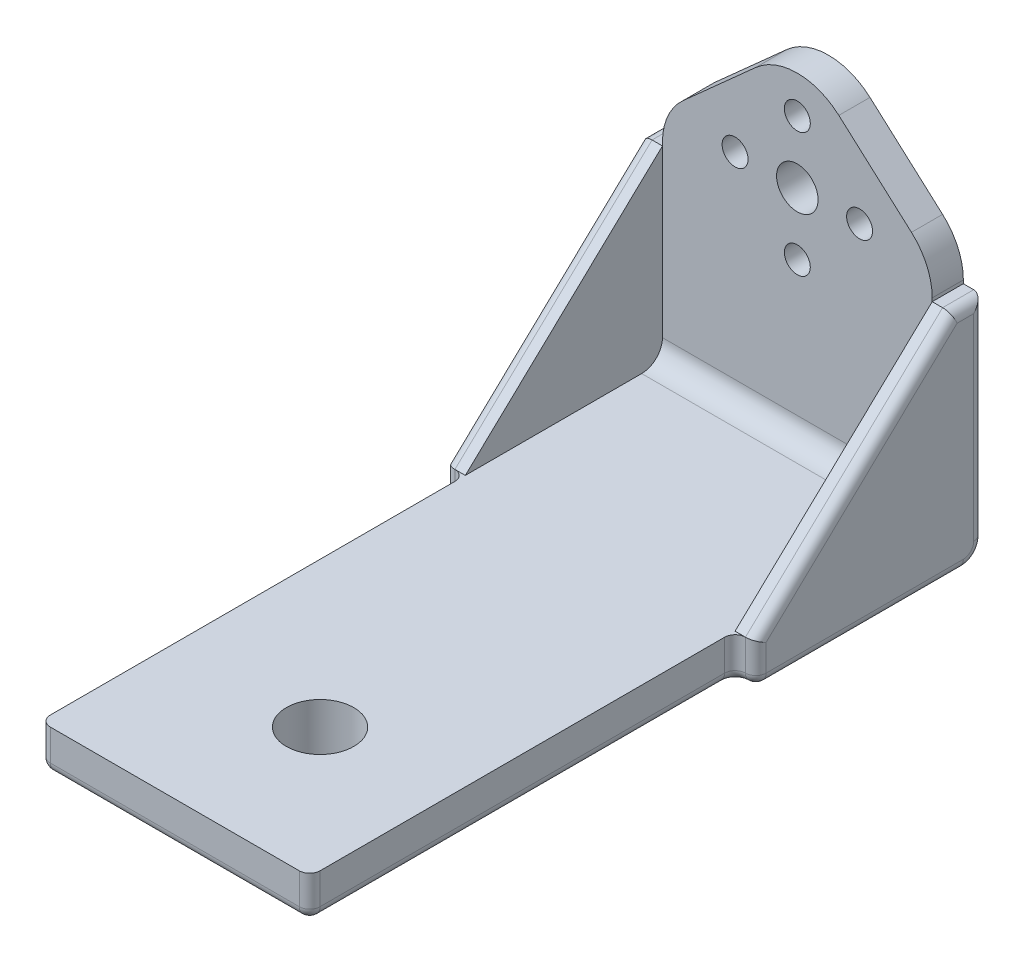
from build123d import *

# Parameters (mm, degrees)
SKETCH1_R           = 2
SKETCH1_R_2         = 1.25
BOSS_EXTRUDE1_DEPTH = 3
SKETCH2_W           = 26
SKETCH2_H           = 4
BOSS_EXTRUDE2_DEPTH = 60
SKETCH3_R           = 3.25
CUT_EXTRUDE1_DEPTH  = 72.226350639
SKETCH4_R           = 8
SKETCH4_R_2         = 3.25
BOSS_EXTRUDE3_DEPTH = 1
SKETCH5_R           = 1.5
BOSS_EXTRUDE4_DEPTH = 3
BOSS_EXTRUDE5_DEPTH = 2
FILLET1_R           = 2
FILLET2_R           = 1
FILLET3_R           = 0.5


# Some blends are built 0.0001 mm under size
with BuildPart() as part:
    # Sketch1 → Boss-Extrude1 (new body)
    with BuildSketch(Plane.XY):
        with BuildLine():
            Line((-13, -2.68256679), (-13, -25))
            Line((-13, -25), (13, -25))
            Line((13, -25), (13, -2.68256679))
            ThreePointArc((13, -2.68256679), (12.477468733, -0.233620837), (11.000887907, 1.788774838))
            Line((11.000887907, 1.788774838), (4.000887907, 8.052267471))
            ThreePointArc((4.000887907, 8.052267471), (0, 9.580925842), (-4.000887907, 8.052267471))
            Line((-4.000887907, 8.052267471), (-11.000887907, 1.788774838))
            ThreePointArc((-11.000887907, 1.788774838), (-12.477468733, -0.233620837), (-13, -2.68256679))
        make_face()
        Circle(SKETCH1_R, mode=Mode.SUBTRACT)
        with Locations((-6, 0)):
            Circle(SKETCH1_R_2, mode=Mode.SUBTRACT)
        with Locations((0, 6)):
            Circle(SKETCH1_R_2, mode=Mode.SUBTRACT)
        with Locations((6, 0)):
            Circle(SKETCH1_R_2, mode=Mode.SUBTRACT)
        with Locations((0, -6)):
            Circle(SKETCH1_R_2, mode=Mode.SUBTRACT)
    extrude(amount=BOSS_EXTRUDE1_DEPTH)

    # Sketch2 → Boss-Extrude2 (add)
    with BuildSketch(Plane.XY.offset(3)):
        with Locations((0, -23)):
            Rectangle(SKETCH2_W, SKETCH2_H)
    extrude(amount=BOSS_EXTRUDE2_DEPTH)

    # Sketch3 → Cut-Extrude1 (cut, through all)
    with BuildSketch(Plane(origin=(0, -21, 0), x_dir=(1, 0, 0), z_dir=(0, 1, 0))):
        with Locations(Location((1, -50, 0), (0, 0, 270))):
            Circle(SKETCH3_R)
    extrude(amount=-CUT_EXTRUDE1_DEPTH, mode=Mode.SUBTRACT)

    # Sketch4 → Boss-Extrude3 (add)
    with BuildSketch(Plane.XZ.offset(25)):
        with Locations(Location((1, 50, 0), (0, 0, 180))):
            Circle(SKETCH4_R)
        with Locations(Location((1, 50, 0), (0, 0, 90))):
            Circle(SKETCH4_R_2, mode=Mode.SUBTRACT)
    extrude(amount=BOSS_EXTRUDE3_DEPTH)

    # Sketch5 → Boss-Extrude4 (add)
    with BuildSketch(Plane.XZ.offset(25)):
        with Locations(Location((-7.5, 10, 0), (0, 0, 180))):
            Circle(SKETCH5_R)
        with Locations(Location((7.5, 10, 0), (0, 0, 180))):
            Circle(SKETCH5_R)
    extrude(amount=BOSS_EXTRUDE4_DEPTH)

    # Sketch6 → Boss-Extrude5 (add)
    with BuildSketch(Plane.ZY.offset(13)):
        Polygon((0, -3), (3, -3), (22, -21), (22, -25), (0, -25), align=None)
    boss_extrude5 = extrude(amount=BOSS_EXTRUDE5_DEPTH)

    # Mirror1: Boss-Extrude5 across plane
    add(boss_extrude5.mirror(Plane(origin=(0, 0, 0), x_dir=(0, 0, 1), z_dir=(1, 0, 0))))

    # Fillet1
    fillet1_edges = [part.edges().sort_by_distance(p)[0] for p in [
        (0, -25, 0),
        (0, -21, 3),
    ]]
    fillet(fillet1_edges, radius=FILLET1_R)

    # Fillet2
    # the kernel refuses this fillet: 1 mm, written as the material it adds along each edge
    with BuildSketch(Plane(origin=(13, -21, 22), x_dir=(1, 0, 0), z_dir=(0, -1, 0)), Plane(origin=(-13, -21, 22), x_dir=(0, 0, 1), z_dir=(0, -1, 0))) as fillet2_piece_1:
        with BuildLine():
            CenterArc((FILLET2_R, FILLET2_R), FILLET2_R, 180, 90)
            Line((0, FILLET2_R), (-FILLET2_R * 0.02, FILLET2_R))
            Line((-FILLET2_R * 0.02, FILLET2_R), (-FILLET2_R * 0.02, -FILLET2_R * 0.02))
            Line((-FILLET2_R * 0.02, -FILLET2_R * 0.02), (FILLET2_R, -FILLET2_R * 0.02))
            Line((FILLET2_R, -FILLET2_R * 0.02), (FILLET2_R, 0))
        make_face()
    extrude(amount=4)
    fillet2_2_edges = [part.edges().sort_by_distance(p)[0] for p in [
        (15, -13, 0),
        (15, -3, 1.5),
        (15, -12, 12.5),
        (15, -23, 22),
        (15, -25, 12),
        (-15, -25, 12),
        (15, -24.414213562, 0.585786438),
        (-15, -24.414213562, 0.585786438),
        (-13, -23, 63),
        (0, -25, 63),
        (13, -23, 63),
        (-15, -13, 0),
        (-15, -23, 22),
        (-15, -12, 12.5),
        (-15, -3, 1.5),
    ]]
    fillet(fillet2_2_edges, radius=FILLET2_R - 0.0001)  # a hair under: the kernel refuses the full size
    # the kernel refuses this fillet: 1 mm, written as the material it takes off along each edge
    with BuildSketch(Plane(origin=(-15, -24, 21), x_dir=(0, -1, 0), z_dir=(0, 0, -1))) as fillet2_3_piece_1:
        with BuildLine():
            CenterArc((0.0001, -0.9999), 0.9999, 0, 90)
            Line((1, -0.9999), (1, 0))
            Line((1, 0), (0.0001, 0))
        make_face()
    revolve(axis=Axis((-15, -24, 21), (-1, 0, 0)), revolution_arc=90, mode=Mode.SUBTRACT)
    with BuildSketch(Plane(origin=(12, -24, 63), x_dir=(0, -1, 0), z_dir=(-1, 0, 0))) as fillet2_3_piece_2:
        with BuildLine():
            CenterArc((0.0001, -0.9999), 0.9999, 0, 90)
            Line((1, -0.9999), (1, 0))
            Line((1, 0), (0.0001, 0))
        make_face()
    revolve(axis=Axis((12, -24, 63), (0, 0, 1)), revolution_arc=90, mode=Mode.SUBTRACT)
    with BuildSketch(Plane(origin=(-12, -24, 63), x_dir=(-1, 0, 0), z_dir=(0, 1, 0))) as fillet2_3_piece_3:
        with BuildLine():
            CenterArc((0.0001, -0.9999), 0.9999, 0, 90)
            Line((1, -0.9999), (1, 0))
            Line((1, 0), (0.0001, 0))
        make_face()
    revolve(axis=Axis((-12, -24, 63), (0, 0, 1)), revolution_arc=90, mode=Mode.SUBTRACT)
    with BuildSketch(Plane(origin=(15, -24, 21), x_dir=(0, 0, 1), z_dir=(0, 1, 0))) as fillet2_3_piece_4:
        with BuildLine():
            CenterArc((0.0001, -0.9999), 0.9999, 0, 90)
            Line((1, -0.9999), (1, 0))
            Line((1, 0), (0.0001, 0))
        make_face()
    revolve(axis=Axis((15, -24, 21), (1, 0, 0)), revolution_arc=90, mode=Mode.SUBTRACT)
    with BuildSketch(Plane(origin=(14, -25, 22), x_dir=(0, 0, -1), z_dir=(1, 0, 0))) as fillet2_3_piece_5:
        with BuildLine():
            CenterArc((FILLET2_R, FILLET2_R), FILLET2_R, 180, 90)
            Line((0, FILLET2_R), (-FILLET2_R * 0.02, FILLET2_R))
            Line((-FILLET2_R * 0.02, FILLET2_R), (-FILLET2_R * 0.02, -FILLET2_R * 0.02))
            Line((-FILLET2_R * 0.02, -FILLET2_R * 0.02), (FILLET2_R, -FILLET2_R * 0.02))
            Line((FILLET2_R, -FILLET2_R * 0.02), (FILLET2_R, 0))
        make_face()
    extrude(amount=1, mode=Mode.SUBTRACT)
    with BuildSketch(Plane(origin=(-13, -25, 23), x_dir=(1, 0, 0), z_dir=(0, 0, 1))) as fillet2_3_piece_6:
        with BuildLine():
            CenterArc((FILLET2_R, FILLET2_R), FILLET2_R, 180, 90)
            Line((0, FILLET2_R), (-FILLET2_R * 0.02, FILLET2_R))
            Line((-FILLET2_R * 0.02, FILLET2_R), (-FILLET2_R * 0.02, -FILLET2_R * 0.02))
            Line((-FILLET2_R * 0.02, -FILLET2_R * 0.02), (FILLET2_R, -FILLET2_R * 0.02))
            Line((FILLET2_R, -FILLET2_R * 0.02), (FILLET2_R, 0))
        make_face()
    extrude(amount=40, mode=Mode.SUBTRACT)
    with BuildSketch(Plane(origin=(13, -25, 23), x_dir=(-1, 0, 0), z_dir=(0, 0, 1))) as fillet2_3_piece_7:
        with BuildLine():
            CenterArc((FILLET2_R, -FILLET2_R), FILLET2_R, 90, 90)
            Line((0, -FILLET2_R), (-FILLET2_R * 0.02, -FILLET2_R))
            Line((-FILLET2_R * 0.02, -FILLET2_R), (-FILLET2_R * 0.02, FILLET2_R * 0.02))
            Line((-FILLET2_R * 0.02, FILLET2_R * 0.02), (FILLET2_R, FILLET2_R * 0.02))
            Line((FILLET2_R, FILLET2_R * 0.02), (FILLET2_R, 0))
        make_face()
    extrude(amount=40, mode=Mode.SUBTRACT)
    with BuildSketch(Plane(origin=(-14, -25, 22), x_dir=(0, 0, -1), z_dir=(-1, 0, 0))) as fillet2_3_piece_8:
        with BuildLine():
            CenterArc((FILLET2_R, -FILLET2_R), FILLET2_R, 90, 90)
            Line((0, -FILLET2_R), (-FILLET2_R * 0.02, -FILLET2_R))
            Line((-FILLET2_R * 0.02, -FILLET2_R), (-FILLET2_R * 0.02, FILLET2_R * 0.02))
            Line((-FILLET2_R * 0.02, FILLET2_R * 0.02), (FILLET2_R, FILLET2_R * 0.02))
            Line((FILLET2_R, FILLET2_R * 0.02), (FILLET2_R, 0))
        make_face()
    extrude(amount=1, mode=Mode.SUBTRACT)
    with BuildSketch(Plane(origin=(-14, -25, 23), x_dir=(1, 0, 0), z_dir=(0, 0, 1))) as fillet2_3_piece_9:
        with BuildLine():
            CenterArc((1 + FILLET2_R, FILLET2_R), FILLET2_R, 180, 90)
            Line((1 + FILLET2_R, 0), (1 + FILLET2_R, -FILLET2_R * 0.02))
            Line((1 + FILLET2_R, -FILLET2_R * 0.02), (1 - FILLET2_R * 0.02, -FILLET2_R * 0.02))
            Line((1 - FILLET2_R * 0.02, -FILLET2_R * 0.02), (1 - FILLET2_R * 0.02, FILLET2_R))
            Line((1 - FILLET2_R * 0.02, FILLET2_R), (1, FILLET2_R))
        make_face()
    revolve(axis=Axis((-14, -25, 23), (0, 1, 0)), revolution_arc=90, mode=Mode.SUBTRACT)
    with BuildSketch(Plane(origin=(14, -25, 23), x_dir=(0, 0, -1), z_dir=(1, 0, 0))) as fillet2_3_piece_10:
        with BuildLine():
            CenterArc((1 + FILLET2_R, FILLET2_R), FILLET2_R, 180, 90)
            Line((1 + FILLET2_R, 0), (1 + FILLET2_R, -FILLET2_R * 0.02))
            Line((1 + FILLET2_R, -FILLET2_R * 0.02), (1 - FILLET2_R * 0.02, -FILLET2_R * 0.02))
            Line((1 - FILLET2_R * 0.02, -FILLET2_R * 0.02), (1 - FILLET2_R * 0.02, FILLET2_R))
            Line((1 - FILLET2_R * 0.02, FILLET2_R), (1, FILLET2_R))
        make_face()
    revolve(axis=Axis((14, -25, 23), (0, 1, 0)), revolution_arc=90, mode=Mode.SUBTRACT)

    # Fillet3
    fillet3_edges = [part.edges().sort_by_distance(p)[0] for p in [
        (-6, -28, 10),
        (9, -28, 10),
    ]]
    fillet(fillet3_edges, radius=FILLET3_R)


solid = part.part
